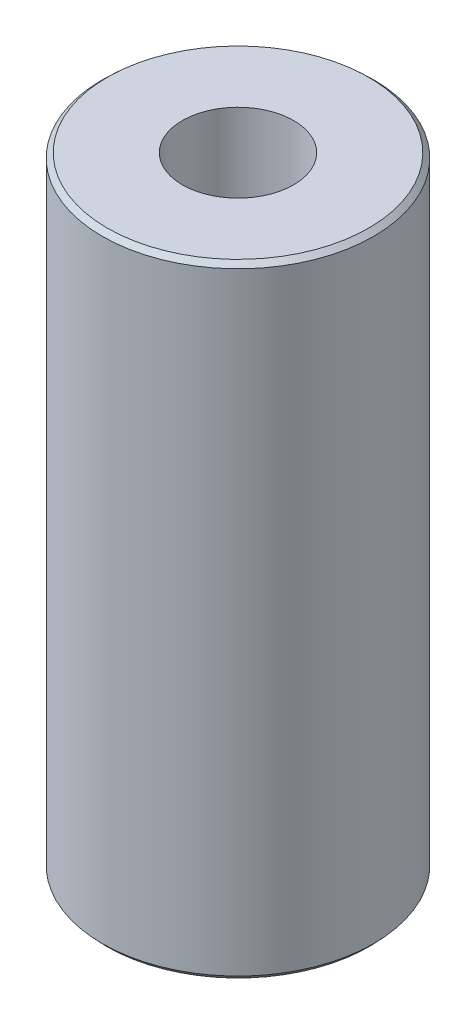
from build123d import *
from OCP.BRepFilletAPI import BRepFilletAPI_MakeChamfer

# Parameters (mm, degrees)
SKETCH1_R           = 50
BOSS_EXTRUDE1_DEPTH = 229.325047443
SKETCH2_R           = 20.527507762
CUT_EXTRUDE1_DEPTH  = 240.979118643
CHAMFER1_SIZE       = 1.711574664
CHAMFER1_SIZE2      = 1.834402564


with BuildPart() as part:
    # Sketch1 → Boss-Extrude1 (new body)
    with BuildSketch(Plane(origin=(0, 0, 0), x_dir=(1, 0, 0), z_dir=(0, 1, 0))):
        Circle(SKETCH1_R)
    extrude(amount=BOSS_EXTRUDE1_DEPTH)

    # Sketch2 → Cut-Extrude1 (cut, through all)
    with BuildSketch(Plane(origin=(0, 0, 0), x_dir=(1, 0, 0), z_dir=(0, 1, 0))):
        Circle(SKETCH2_R)
    extrude(amount=CUT_EXTRUDE1_DEPTH, mode=Mode.SUBTRACT)

    # Chamfer1: one chamfer whose edges measure the first distance from different faces: ONE call of the kernel's chamfer builder (chamfer() names one face for all edges)
    chamfer1_edges_1 = [part.edges().sort_by_distance(p)[0] for p in [
        (-50, 229.325047443, 0),
    ]]
    chamfer1_side_1 = [part.faces().sort_by_distance(p)[0] for p in [
        (-50, 114.662523721, 0),
    ]]
    chamfer1_edges_2 = [part.edges().sort_by_distance(p)[0] for p in [
        (-50, 0, 0),
    ]]
    chamfer1_side_2 = [part.faces().sort_by_distance(p)[0] for p in [
        (-48.585786438, 0, 0),
    ]]
    chamfer1 = BRepFilletAPI_MakeChamfer(part.part.solid().wrapped)
    for e in chamfer1_edges_1:
        chamfer1.Add(CHAMFER1_SIZE, CHAMFER1_SIZE2, e.wrapped, chamfer1_side_1[0].wrapped)  # the first distance lies on this face
    for e in chamfer1_edges_2:
        chamfer1.Add(CHAMFER1_SIZE, CHAMFER1_SIZE2, e.wrapped, chamfer1_side_2[0].wrapped)  # the first distance lies on this face
    add(Compound.cast(chamfer1.Shape()), mode=Mode.REPLACE)


solid = part.part
